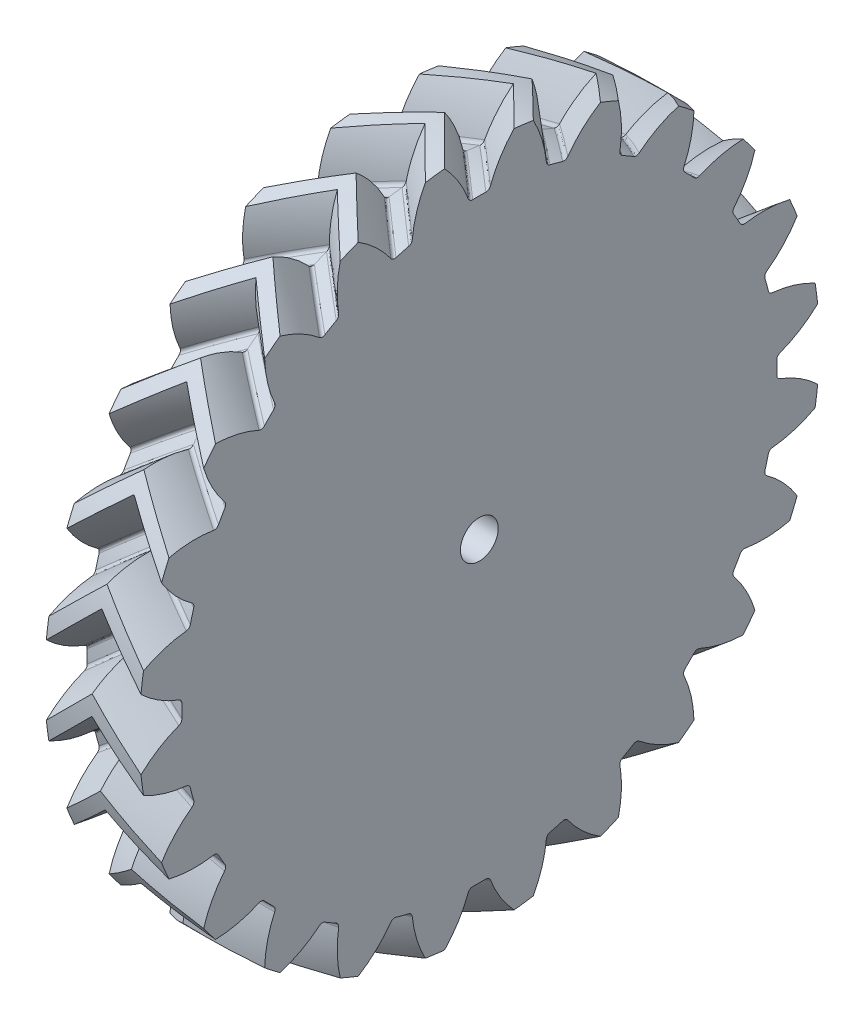
from build123d import *

# Parameters (mm, degrees)
BASPROSKE_W             = 5
BASPROSKE_H             = 35.941125497
TOOTHCUTLH_PITCH        = 225.824751646
TOOTHCUTLH_HEIGHT       = 5
TOOTHCUTLH_RADIUS       = 35.941125497
TOOTHCUTLH_START_ANGLE  = -90
TEETHCUTSLH_COUNT       = 24
TEETHCUTSLH_ANGLE       = 345
BORSKE_R                = 2
BORE_DEPTH              = 62.5000025
CROQUIS1_R              = 7.5
CROQUIS1_R_2            = 2
SALIENTE_EXTRUIR1_DEPTH = 15
CROQUIS2_R              = 2
CORTAR_EXTRUIR1_DEPTH   = 15
CROQUIS3_R              = 12.294312863
CORTAR_EXTRUIR2_DEPTH   = 18


with BuildPart() as part:
    # BasProSke → Base-Revolve (revolve)
    with BuildSketch(Plane(origin=(0, 0, 0), x_dir=(1, 0, 0), z_dir=(0, 1, 0)), mode=Mode.PRIVATE) as base_revolve_sk:
        with Locations((2.5, 17.970562749)):
            Rectangle(BASPROSKE_W, BASPROSKE_H)
    revolve(base_revolve_sk.sketch.rotate(Axis((-10, 0, 0), (1, 0, 0)), 180), axis=Axis((-10, 0, 0), (1, 0, 0)))

    # ToothCutLH: sweep along a helix
    with BuildLine() as toothcutlh_path:
        add(Helix(TOOTHCUTLH_PITCH, TOOTHCUTLH_HEIGHT, TOOTHCUTLH_RADIUS, center=(0, 0, 0), direction=(1, 0, 0), lefthand=True, mode=Mode.PRIVATE).rotate(Axis((0, 0, 0), (1, 0, 0)), TOOTHCUTLH_START_ANGLE))
    # TooCutSkeRH<3> → ToothCutLH (sweep, cut)
    with BuildSketch(Plane(origin=(0, 0, 0), x_dir=(0, 0, -1), z_dir=(1, 0, 0))):
        with BuildLine():
            ThreePointArc((0.693159395, 31.43348378), (0, 31.441125497), (-0.693159395, 31.43348378))
            ThreePointArc((-0.693159395, 31.43348378), (-0.984462219, 31.519083008), (-1.172835459, 31.757200805))
            ThreePointArc((-1.172835459, 31.757200805), (-2.616504489, 34.465911242), (-4.700103219, 36.71977655))
            ThreePointArc((-4.700103219, 36.71977655), (0, 37.019359262), (4.700103219, 36.71977655))
            ThreePointArc((4.700103219, 36.71977655), (2.616504489, 34.465911242), (1.172835459, 31.757200805))
            ThreePointArc((1.172835459, 31.757200805), (0.984462219, 31.519083008), (0.693159395, 31.43348378))
        make_face()
    toothcutlh = sweep(path=toothcutlh_path.line, is_frenet=True, mode=Mode.SUBTRACT)

    # TeethCutsLH: ToothCutLH ×24 about axis
    teethcutslh_axis = Axis((-10, 0, 0), (1, 0, 0))
    for i in range(1, TEETHCUTSLH_COUNT):
        add(toothcutlh.rotate(teethcutslh_axis, i * TEETHCUTSLH_ANGLE / (TEETHCUTSLH_COUNT - 1)), mode=Mode.SUBTRACT)

    # BorSke → Bore (cut, symmetric)
    with BuildSketch(Plane(origin=(0, 0, 0), x_dir=(0, 0, -1), z_dir=(1, 0, 0))):
        with Locations(Location((0, 0, 0), (0, 0, 180))):
            Circle(BORSKE_R)
    extrude(amount=BORE_DEPTH, both=True, mode=Mode.SUBTRACT)

    # Simetría1: part across plane


with BuildPart() as part_1:
    add(part.part)
    add(part.part.mirror(Plane.ZY.offset(-5)))

    # Croquis1 → Saliente-Extruir1 (add)
    with BuildSketch(Plane(origin=(10, 0, 0), x_dir=(0, 0, -1), z_dir=(1, 0, 0))):
        with Locations(Location((0, 0, 0), (0, 0, 180))):
            Circle(CROQUIS1_R)
        Circle(CROQUIS1_R_2, mode=Mode.SUBTRACT)
    saliente_extruir1 = extrude(amount=SALIENTE_EXTRUIR1_DEPTH)

    # Croquis2 → Cortar-Extruir1 (cut)
    with BuildSketch(Plane(origin=(0, 0, 0), x_dir=(1, 0, 0), z_dir=(0, 1, 0))):
        with Locations(Location((16.776413879, 0, 0), (0, 0, 90))):
            Circle(CROQUIS2_R)
    cortar_extruir1 = extrude(amount=CORTAR_EXTRUIR1_DEPTH, mode=Mode.SUBTRACT)

    # Simetría2: Saliente-Extruir1, Cortar-Extruir1 across plane
    add(saliente_extruir1.mirror(Plane.ZY.offset(-5)))
    add(cortar_extruir1.mirror(Plane.ZY.offset(-5)), mode=Mode.SUBTRACT)

    # Croquis3 → Cortar-Extruir2 (cut)
    with BuildSketch(Plane(origin=(10, 0, 0), x_dir=(0, 0, -1), z_dir=(1, 0, 0))):
        Circle(CROQUIS3_R)
    extrude(amount=CORTAR_EXTRUIR2_DEPTH, mode=Mode.SUBTRACT)


solid = part_1.part
